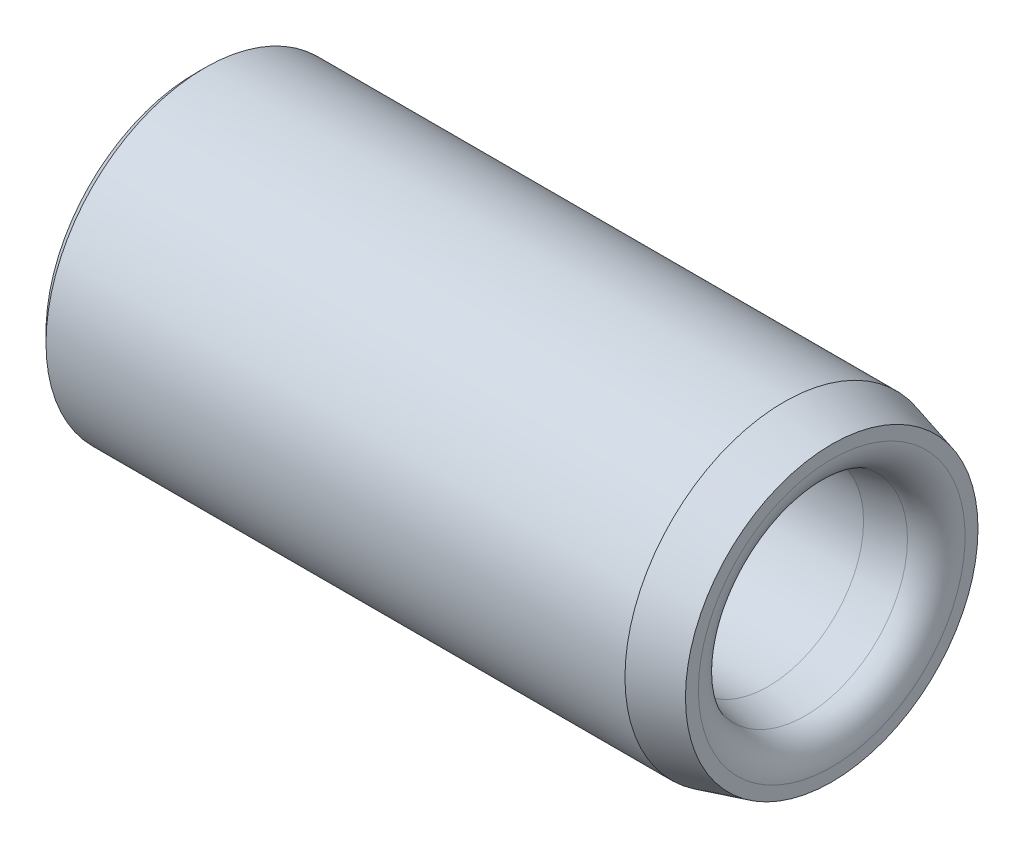
from build123d import *

# Parameters (mm, degrees)
SKETCH1_W      = 20
SKETCH1_H      = 2
CHAMFER1_SIZE  = 0.3
CHAMFER2_SIZE  = 1.5
CHAMFER2_SIZE2 = 0.401923789
CHAMFER3_SIZE  = 2
CHAMFER3_SIZE2 = 0.352653961
FILLET1_R      = 1


with BuildPart() as part:
    # Sketch1 → Revolve1 (revolve)
    with BuildSketch(Plane.XY):
        with Locations((10, 4)):
            Rectangle(SKETCH1_W, SKETCH1_H)
    revolve(axis=Axis((0, 0, 0), (1, 0, 0)))

    # Chamfer1
    chamfer1_edges = [part.edges().sort_by_distance(p)[0] for p in [
        (0, -5, 0),
    ]]
    chamfer(chamfer1_edges, length=CHAMFER1_SIZE)

    # Chamfer2
    chamfer2_edges = [part.edges().sort_by_distance(p)[0] for p in [
        (20, -5, 0),
    ]]
    chamfer2_side = [part.faces().sort_by_distance(p)[0] for p in [
        (10.15, -5, 0),
    ]]
    chamfer(chamfer2_edges, length=CHAMFER2_SIZE, length2=CHAMFER2_SIZE2, reference=chamfer2_side[0])

    # Chamfer3
    chamfer3_edges = [part.edges().sort_by_distance(p)[0] for p in [
        (0, -3, 0),
        (20, -3, 0),
    ]]
    chamfer3_side = [part.faces().sort_by_distance(p)[0] for p in [
        (10, -3, 0),
    ]]
    chamfer(chamfer3_edges, length=CHAMFER3_SIZE, length2=CHAMFER3_SIZE2, reference=chamfer3_side[0])

    # Fillet1
    fillet1_edges = [part.edges().sort_by_distance(p)[0] for p in [
        (0, -3.352653961, 0),
        (20, -3.352653961, 0),
    ]]
    fillet(fillet1_edges, radius=FILLET1_R)


solid = part.part
